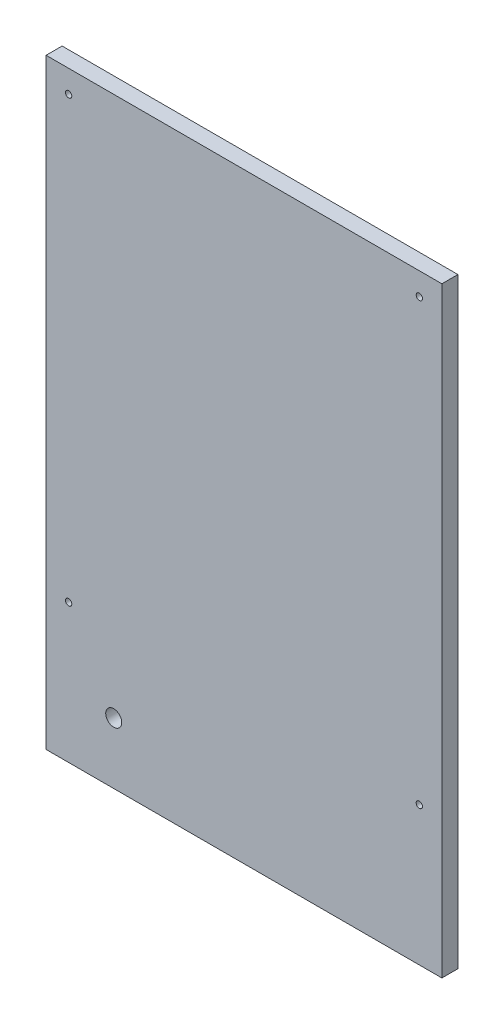
from build123d import *

# Parameters (mm, degrees)
SKETCH1_W            = 395
SKETCH1_H            = 600
BASE_DEPTH           = 16
SKETCH2_R            = 3.15
MOUNTING_HOLES_DEPTH = 719.526965395
TAP_HOLE_REACH       = 720.527
SKETCH4_R            = 8


with BuildPart() as part:
    # Sketch1 → Base (new body)
    with BuildSketch(Plane.XY):
        with Locations((197.5, 300)):
            Rectangle(SKETCH1_W, SKETCH1_H)
    extrude(amount=BASE_DEPTH)

    # Sketch2 → Mounting holes (cut, through all)
    with BuildSketch(Plane.XY.offset(16)):
        with Locations((22.5, 577.5)):
            Circle(SKETCH2_R)
        with Locations((372.5, 577.5)):
            Circle(SKETCH2_R)
        with Locations((22.5, 138.5)):
            Circle(SKETCH2_R)
        with Locations((372.5, 138.5)):
            Circle(SKETCH2_R)
    extrude(amount=-MOUNTING_HOLES_DEPTH, mode=Mode.SUBTRACT)

    # Sketch4 → Tap hole (cut, up to next)
    with BuildSketch(Plane(origin=(0, 0, 0), x_dir=(-1, 0, 0), z_dir=(0, 0, -1)), mode=Mode.PRIVATE) as tap_hole_sk1:
        with Locations((-67.5, 61)):
            Circle(SKETCH4_R)
    tap_hole_tool1 = extrude(tap_hole_sk1.sketch, amount=-TAP_HOLE_REACH, mode=Mode.PRIVATE) & part.part
    add(tap_hole_tool1.solids().sort_by_distance((67.5, 61, 0))[0], mode=Mode.SUBTRACT)


solid = part.part
